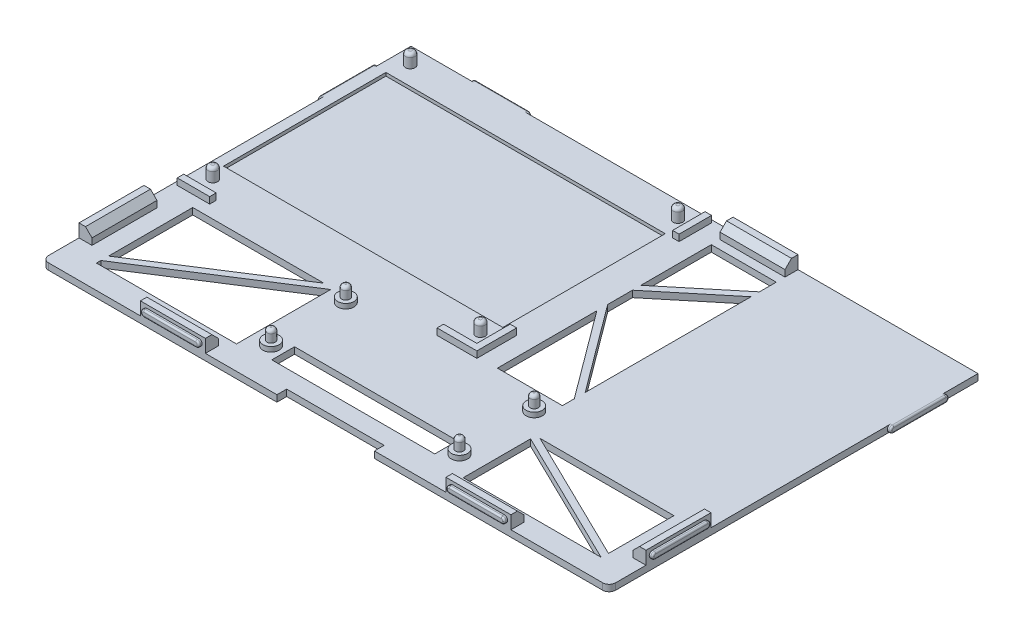
from build123d import *

# Parameters (mm, degrees)
SKETCH_1_W          = 174.55
SKETCH_1_H          = 113.55
EXTRUDE_1_DEPTH     = 2
SKETCH_3_W          = 2
SKETCH_3_H          = 10
SKETCH_3_W_2        = 10
SKETCH_3_H_2        = 2
EXTRUDE_2_DEPTH     = 2
SKETCH_4_R          = 1.45
EXTRUDE_3_DEPTH     = 4
FILLET_2_R          = 1
SKETCH_5_W          = 86
SKETCH_5_H          = 50
CUT_EXTRUDE_1_DEPTH = 1
SKETCH_8_R          = 2.5
EXTRUDE_4_DEPTH     = 1.5
SKETCH_8_3_R        = 1.25
EXTRUDE_5_DEPTH     = 5
FILLET_3_R          = 1
SKETCH_9_W          = 50.159646102
SKETCH_9_H          = 7
SKETCH_9_W_2        = 30
SKETCH_9_H_2        = 3
CUT_EXTRUDE_2_DEPTH = 2
SKETCH_10_W         = 20
SKETCH_10_H         = 4
SKETCH_10_W_2       = 4
SKETCH_10_H_2       = 20
EXTRUDE_6_DEPTH     = 4
CUT_EXTRUDE_3_DEPTH = 105.236875673
FILLET_1_R          = 2
CHAMFER_1_SIZE      = 2
EXTRUDE_8_DEPTH     = 1
EXTRUDE_9_DEPTH     = 1
EXTRUDE_11_DEPTH    = 1
EXTRUDE_START       = 1
EXTRUDE_12_DEPTH    = 1
BOSS_EXTRUDE1_DEPTH = 1
BOSS_EXTRUDE2_DEPTH = 1
FILLET_4_R          = 0.5


with BuildPart() as part:
    # 草圖1 → 填料-伸長1 (new body)
    with BuildSketch(Plane(origin=(0, 0, 0), x_dir=(1, 0, 0), z_dir=(0, 1, 0))):
        Rectangle(SKETCH_1_W, SKETCH_1_H)
    extrude(amount=EXTRUDE_1_DEPTH)

    # 草圖3 → 填料-伸長2 (add)
    with BuildSketch(Plane(origin=(0, 2, 0), x_dir=(1, 0, 0), z_dir=(0, 1, 0))):
        with Locations((5.09, 50.93)):
            Rectangle(SKETCH_3_W, SKETCH_3_H)
        Polygon((4.09, -14.07), (4.09, -4.07), (6.09, -4.07), (6.09, -14.07), (6.09, -15.07), (6.09, -16.32), (-6.16, -16.32), (-6.16, -14.32), (4.09, -14.32), align=None)
        with Locations((-81.16, -15.32)):
            Rectangle(SKETCH_3_W_2, SKETCH_3_H_2)
    extrude(amount=EXTRUDE_2_DEPTH)

    # 草圖4 → 填料-伸長3 (add)
    with BuildSketch(Plane(origin=(0, 2, 0), x_dir=(1, 0, 0), z_dir=(0, 1, 0))):
        with Locations((0.04, 51.63)):
            Circle(SKETCH_4_R)
        with Locations((0.04, -9.17)):
            Circle(SKETCH_4_R)
        with Locations((-82.36, -9.17)):
            Circle(SKETCH_4_R)
        with Locations((-82.36, 51.63)):
            Circle(SKETCH_4_R)
    extrude(amount=EXTRUDE_3_DEPTH)

    # 圓角2
    fillet_2_edges = [part.edges().sort_by_distance(p)[0] for p in [
        (-83.81, 6, -51.63),
        (-83.81, 6, 9.17),
        (-1.41, 6, 9.17),
        (-1.41, 6, -51.63),
    ]]
    fillet(fillet_2_edges, radius=FILLET_2_R)

    # 草圖5 → 除料-伸長1 (cut)
    with BuildSketch(Plane(origin=(0, 2, 0), x_dir=(1, 0, 0), z_dir=(0, 1, 0))):
        with Locations((-41.16, 20.93)):
            Rectangle(SKETCH_5_W, SKETCH_5_H)
    extrude(amount=-CUT_EXTRUDE_1_DEPTH, mode=Mode.SUBTRACT)

    # 草圖8 → 填料-伸長4 (add)
    with BuildSketch(Plane(origin=(0, 2, 0), x_dir=(1, 0, 0), z_dir=(0, 1, 0))):
        with Locations((29, -21.575)):
            Circle(SKETCH_8_R)
        with Locations((29, -44.575)):
            Circle(SKETCH_8_R)
        with Locations((-29, -44.575)):
            Circle(SKETCH_8_R)
        with Locations((-29, -21.575)):
            Circle(SKETCH_8_R)
    extrude(amount=EXTRUDE_4_DEPTH)

    # 草圖8<3> → 填料-伸長5 (add)
    with BuildSketch(Plane(origin=(0, 2, 0), x_dir=(1, 0, 0), z_dir=(0, 1, 0))):
        with Locations((29, -21.575)):
            Circle(SKETCH_8_3_R)
        with Locations((29, -44.575)):
            Circle(SKETCH_8_3_R)
        with Locations((-29, -44.575)):
            Circle(SKETCH_8_3_R)
        with Locations((-29, -21.575)):
            Circle(SKETCH_8_3_R)
    extrude(amount=EXTRUDE_5_DEPTH)

    # 圓角3
    fillet_3_edges = [part.edges().sort_by_distance(p)[0] for p in [
        (-30.25, 7, 44.575),
        (27.75, 7, 44.575),
        (27.75, 7, 21.575),
        (-30.25, 7, 21.575),
    ]]
    fillet(fillet_3_edges, radius=FILLET_3_R)

    # 草圖9 → 除料-伸長2 (cut)
    with BuildSketch(Plane(origin=(0, 2, 0), x_dir=(1, 0, 0), z_dir=(0, 1, 0))):
        with Locations((0, -44.775)):
            Rectangle(SKETCH_9_W, SKETCH_9_H)
        with Locations((0, -55.275)):
            Rectangle(SKETCH_9_W_2, SKETCH_9_H_2)
    extrude(amount=-CUT_EXTRUDE_2_DEPTH, mode=Mode.SUBTRACT)

    # 草圖10 → 填料-伸長6 (add)
    with BuildSketch(Plane(origin=(0, 2, 0), x_dir=(1, 0, 0), z_dir=(0, 1, 0))):
        with Locations((21.854715439, 54.775)):
            Rectangle(SKETCH_10_W, SKETCH_10_H)
        with Locations((85.275, -35.43799868)):
            Rectangle(SKETCH_10_W_2, SKETCH_10_H_2)
        with Locations((47.031889085, -54.775)):
            Rectangle(SKETCH_10_W, SKETCH_10_H)
        with Locations((-47.031889085, -54.775)):
            Rectangle(SKETCH_10_W, SKETCH_10_H)
        with Locations((-85.275, -35.43799868)):
            Rectangle(SKETCH_10_W_2, SKETCH_10_H_2)
    extrude(amount=EXTRUDE_6_DEPTH)

    # 草圖11 → 除料-伸長3 (cut, through all)
    with BuildSketch(Plane(origin=(0, 2, 0), x_dir=(1, 0, 0), z_dir=(0, 1, 0))):
        Polygon((-77.879578173, -45.722583606), (-37.497069547, -19.823892626), (-77.879578173, -19.823892626), align=None)
        Polygon((-77.879578173, -49.467196386), (-34.764514275, -49.467196386), (-34.764514275, -20.447382192), (-77.879578173, -48.098554803), align=None)
        Polygon((31.854715439, 44.917489498), (11.854715439, 28.410289152), (11.854715439, 50.090728689), (31.854715439, 50.090728689), align=None)
        Polygon((11.854715439, -15.752914676), (31.854715439, -15.752914676), (31.854715439, -12.091582027), (11.854715439, 14.843632999), align=None)
        Polygon((11.854715439, 25.817052443), (31.854715439, 42.324252788), (31.854715439, -8.736726131), (11.854715439, 18.198488896), align=None)
        Polygon((78.359380095, -48.062791021), (37.115806701, -27.915068386), (78.359380095, -27.915068386), align=None)
        Polygon((35.80419089, -29.5002187), (35.80419089, -50.229107424), (78.237445455, -50.229107424), align=None)
    extrude(amount=-CUT_EXTRUDE_3_DEPTH, mode=Mode.SUBTRACT)

    # 圓角1
    fillet_1_edges = [part.edges().sort_by_distance(p)[0] for p in [
        (-87.275, 1, 56.775),
        (87.275, 1, 56.775),
    ]]
    fillet(fillet_1_edges, radius=FILLET_1_R)

    # 導角1
    chamfer_1_edges = [part.edges().sort_by_distance(p)[0] for p in [
        (83.275, 6, 35.43799868),
        (47.031889085, 6, 52.775),
        (-47.031889085, 6, 52.775),
        (21.854715439, 6, -52.775),
        (-83.275, 6, 35.43799868),
    ]]
    chamfer(chamfer_1_edges, length=CHAMFER_1_SIZE)

    # 草圖13 → 填料-伸長8 (add)
    with BuildSketch(Plane(origin=(87.275, 0, 0), x_dir=(0, 0, -1), z_dir=(1, 0, 0))):
        with BuildLine():
            Line((-43.43799868, 5), (-27.43799868, 5))
            ThreePointArc((-27.43799868, 5), (-26.43799868, 4), (-27.43799868, 3))
            Line((-27.43799868, 3), (-43.43799868, 3))
            ThreePointArc((-43.43799868, 3), (-44.43799868, 4), (-43.43799868, 5))
        make_face()
    extrude(amount=EXTRUDE_8_DEPTH)

    # 草圖14 → 填料-伸長9 (add)
    with BuildSketch(Plane(origin=(0, 0, -56.775), x_dir=(-1, 0, 0), z_dir=(0, 0, -1))):
        with BuildLine():
            Line((-29.854715439, 5), (-13.854715439, 5))
            ThreePointArc((-13.854715439, 5), (-12.854715439, 4), (-13.854715439, 3))
            Line((-13.854715439, 3), (-29.854715439, 3))
            ThreePointArc((-29.854715439, 3), (-30.854715439, 4), (-29.854715439, 5))
        make_face()
    extrude(amount=EXTRUDE_9_DEPTH)

    # 草圖15 → 填料-伸長11 (add)
    with BuildSketch(Plane.XY.offset(56.775)):
        with BuildLine():
            Line((-55.031889085, 5), (-39.031889085, 5))
            ThreePointArc((-39.031889085, 5), (-38.031889085, 4), (-39.031889085, 3))
            Line((-39.031889085, 3), (-55.031889085, 3))
            ThreePointArc((-55.031889085, 3), (-56.031889085, 4), (-55.031889085, 5))
        make_face()
        with BuildLine():
            Line((55.031889085, 5), (39.031889085, 5))
            ThreePointArc((39.031889085, 5), (38.031889085, 4), (39.031889085, 3))
            Line((39.031889085, 3), (55.031889085, 3))
            ThreePointArc((55.031889085, 3), (56.031889085, 4), (55.031889085, 5))
        make_face()
    extrude(amount=EXTRUDE_11_DEPTH)

    # 草圖16 → 填料-伸長12 (add)
    with BuildSketch(Plane.ZY.offset(87.275).offset(EXTRUDE_START)):
        with BuildLine():
            Line((27.43799868, 5), (43.43799868, 5))
            ThreePointArc((43.43799868, 5), (44.43799868, 4), (43.43799868, 3))
            Line((43.43799868, 3), (27.43799868, 3))
            ThreePointArc((27.43799868, 3), (26.43799868, 4), (27.43799868, 5))
        make_face()
    extrude(amount=-EXTRUDE_12_DEPTH)

    # Sketch1 → Boss-Extrude1 (add)
    with BuildSketch(Plane(origin=(0, 0, -56.775), x_dir=(-1, 0, 0), z_dir=(0, 0, -1))):
        with BuildLine():
            Line((68.15, 0), (52.15, 0))
            ThreePointArc((52.15, 0), (51.15, 1), (52.15, 2))
            Line((52.15, 2), (68.15, 2))
            ThreePointArc((68.15, 2), (69.15, 1), (68.15, 0))
        make_face()
    extrude(amount=BOSS_EXTRUDE1_DEPTH)

    # Sketch2 → Boss-Extrude2 (add)
    with BuildSketch(Plane(origin=(87.275, 0, 0), x_dir=(0, 0, -1), z_dir=(1, 0, 0))):
        with BuildLine():
            Line((29.84, 2), (45.84, 2))
            ThreePointArc((45.84, 2), (46.84, 1), (45.84, 0))
            Line((45.84, 0), (29.84, 0))
            ThreePointArc((29.84, 0), (28.84, 1), (29.84, 2))
        make_face()
    boss_extrude2 = extrude(amount=BOSS_EXTRUDE2_DEPTH)

    # Mirror1: Boss-Extrude2 across plane
    add(boss_extrude2.mirror(Plane.ZY))

    # 圓角4
    fillet_4_edges = [part.edges().sort_by_distance(p)[0] for p in [
        (12.854715439, 4, -57.775),
        (21.854715439, 3, -57.775),
        (30.854715439, 4, -57.775),
        (88.275, 4, 26.43799868),
        (88.275, 3, 35.43799868),
        (88.275, 4, 44.43799868),
        (56.031889085, 4, 57.775),
        (47.031889085, 3, 57.775),
        (38.031889085, 4, 57.775),
        (-88.275, 4, 44.43799868),
        (-88.275, 3, 35.43799868),
        (-88.275, 4, 26.43799868),
        (-38.031889085, 4, 57.775),
        (-47.031889085, 3, 57.775),
        (-56.031889085, 4, 57.775),
        (21.854715439, 5, -57.775),
        (88.275, 5, 35.43799868),
        (47.031889085, 5, 57.775),
        (-88.275, 5, 35.43799868),
        (-47.031889085, 5, 57.775),
        (-88.275, 1, -46.84),
        (-88.275, 0, -37.84),
        (-88.275, 1, -28.84),
        (88.275, 1, -46.84),
        (88.275, 0, -37.84),
        (88.275, 1, -28.84),
        (-69.15, 1, -57.775),
        (-60.15, 0, -57.775),
        (-51.15, 1, -57.775),
        (-88.275, 2, -37.84),
        (88.275, 2, -37.84),
        (-60.15, 2, -57.775),
    ]]
    fillet(fillet_4_edges, radius=FILLET_4_R)


solid = part.part
